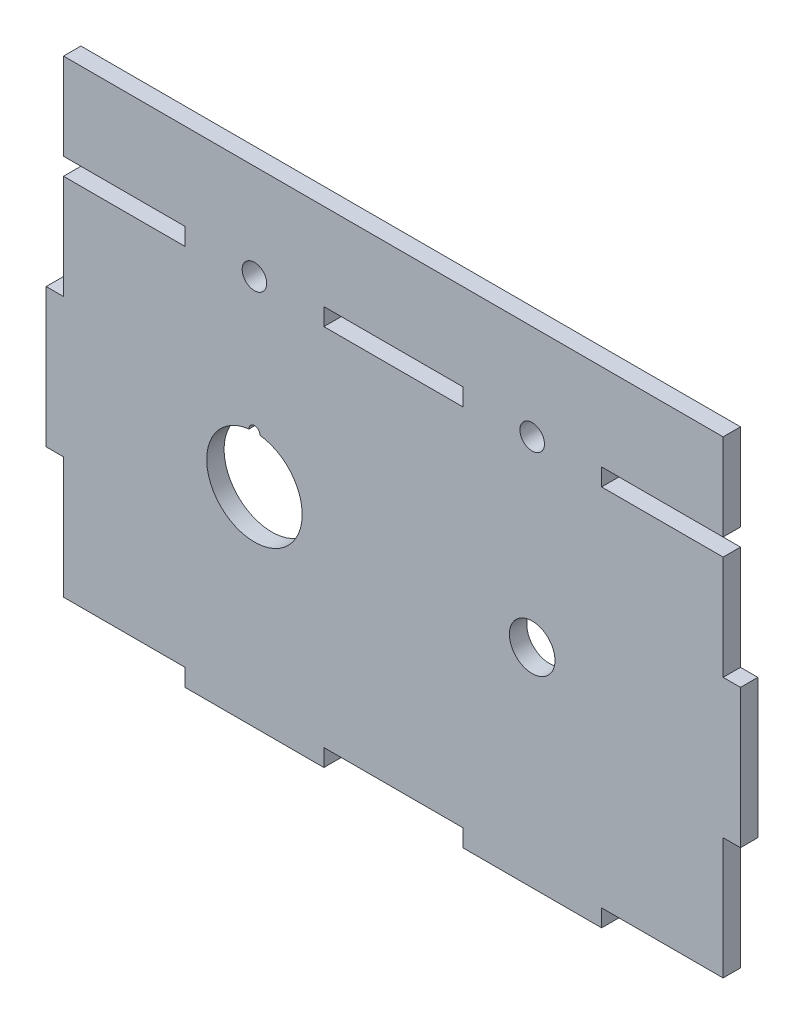
from build123d import *

# Parameters (mm, degrees)
SKETCH1_W                 = 127
SKETCH1_H                 = 88.9
BOSS_EXTRUDE1_DEPTH       = 3.175
SKETCH5_W                 = 3.175
SKETCH5_H                 = 25.4
CUT_EXTRUDE4_DEPTH        = 6.35
SKETCH6_W                 = 25.4
SKETCH6_H                 = 3.175
CUT_EXTRUDE5_DEPTH        = 6.35
LPATTERN5_COUNT           = 2
LPATTERN5_PITCH           = 50.8
LPATTERN5_COUNT_DIR2      = 2
LPATTERN5_PITCH_DIR2      = 123.825
LPATTERN6_COUNT           = 3
LPATTERN6_PITCH           = 50.8
LPATTERN6_COUNT_DIR2      = 2
LPATTERN6_PITCH_DIR2      = 69.85
F_8_CLEARANCE_HOLE1_D     = 4.4958
F_8_CLEARANCE_HOLE1_DEPTH = 10.16
F_8_CLEARANCE_HOLE1_TIP   = 1.350674586
SKETCH11_W                = 3.175
SKETCH11_H                = 12.7
CUT_EXTRUDE6_DEPTH        = 7.62
CUT_EXTRUDE7_DEPTH        = 7.62
SKETCH13_R                = 4.1671875
CUT_EXTRUDE8_DEPTH        = 7.62


with BuildPart() as part:
    # Sketch1 → Boss-Extrude1 (new body)
    with BuildSketch(Plane.XY):
        with Locations((63.5, 44.45)):
            Rectangle(SKETCH1_W, SKETCH1_H)
    extrude(amount=BOSS_EXTRUDE1_DEPTH)

    # Sketch5 → Cut-Extrude4 (cut)
    with BuildSketch(Plane.XY.offset(3.175)):
        with Locations((1.5875, 12.7)):
            Rectangle(SKETCH5_W, SKETCH5_H)
    cut_extrude4 = extrude(amount=-CUT_EXTRUDE4_DEPTH, mode=Mode.SUBTRACT)

    # Sketch6 → Cut-Extrude5 (cut)
    with BuildSketch(Plane.XY.offset(3.175)):
        with Locations((12.7, 1.5875)):
            Rectangle(SKETCH6_W, SKETCH6_H)
    cut_extrude5 = extrude(amount=-CUT_EXTRUDE5_DEPTH, mode=Mode.SUBTRACT)

    # LPattern5: Cut-Extrude4 2 × 2
    with Locations(*[(j * LPATTERN5_PITCH_DIR2, i * LPATTERN5_PITCH, 0) for i in range(LPATTERN5_COUNT) for j in range(LPATTERN5_COUNT_DIR2) if (i, j) != (0, 0)]):
        add(cut_extrude4, mode=Mode.SUBTRACT)

    # LPattern6: Cut-Extrude5 3 × 2
    with Locations(*[(i * LPATTERN6_PITCH, j * LPATTERN6_PITCH_DIR2, 0) for i in range(LPATTERN6_COUNT) for j in range(LPATTERN6_COUNT_DIR2) if (i, j) != (0, 0)]):
        add(cut_extrude5, mode=Mode.SUBTRACT)

    # #8 Clearance Hole1
    with Locations(Plane.XY.offset(3.175)):
        with Locations((38.1, 71.4375), (88.9, 71.4375)):
            Hole(F_8_CLEARANCE_HOLE1_D / 2, depth=F_8_CLEARANCE_HOLE1_DEPTH)
            with Locations((0, 0, -(F_8_CLEARANCE_HOLE1_DEPTH + F_8_CLEARANCE_HOLE1_TIP / 2))):  # 118° drill point
                Cone(0, F_8_CLEARANCE_HOLE1_D / 2, F_8_CLEARANCE_HOLE1_TIP, mode=Mode.SUBTRACT)

    # Sketch11 → Cut-Extrude6 (cut)
    with BuildSketch(Plane.XY.offset(3.175)):
        with Locations((1.5875, 82.55)):
            Rectangle(SKETCH11_W, SKETCH11_H)
        with Locations((125.4125, 82.55)):
            Rectangle(SKETCH11_W, SKETCH11_H)
    extrude(amount=-CUT_EXTRUDE6_DEPTH, mode=Mode.SUBTRACT)

    # Sketch12 → Cut-Extrude7 (cut)
    with BuildSketch(Plane.XY.offset(3.175)):
        with BuildLine():
            ThreePointArc((37.101641019, 46.773984431), (38.1, 29.36875), (39.098358981, 46.773984431))
            ThreePointArc((39.098358981, 46.773984431), (38.1, 47.83125), (37.101641019, 46.773984431))
        make_face()
    extrude(amount=-CUT_EXTRUDE7_DEPTH, mode=Mode.SUBTRACT)

    # Sketch13 → Cut-Extrude8 (cut)
    with BuildSketch(Plane.XY.offset(3.175)):
        with Locations((88.9, 38.1)):
            Circle(SKETCH13_R)
    extrude(amount=-CUT_EXTRUDE8_DEPTH, mode=Mode.SUBTRACT)


solid = part.part
